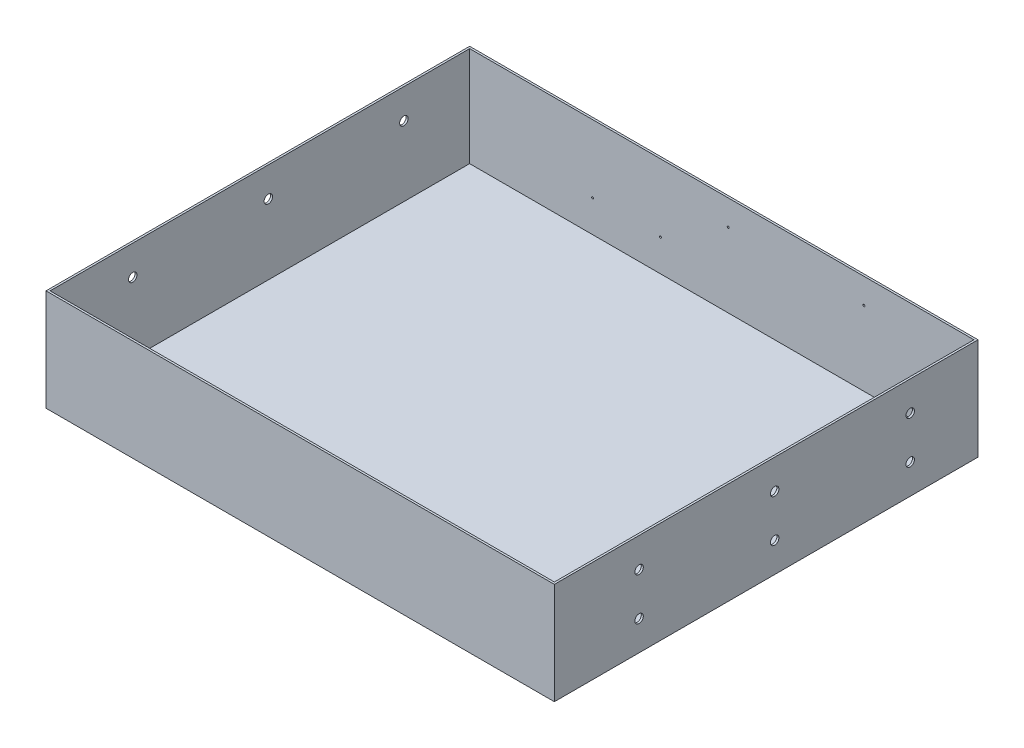
from build123d import *

# Parameters (mm, degrees)
SKETCH1_W                          = 762
SKETCH1_H                          = 635
EXTRUDE1_DEPTH                     = 152.4
SHELL1_T                           = -3.048
SKETCH2_R                          = 6.35
CONNECTOR_MOUNT_CUT_EXTRUDE1_DEPTH = 929.403877631
LPATTERN1_START                    = -508
LPATTERN1_OUTLINE_R                = 6.35
LPATTERN1_DEPTH                    = 3.048
LPATTERN5_START                    = 250.952
LPATTERN5_OUTLINE_R                = 6.35
LPATTERN5_DEPTH                    = 3.048
SKETCH3_R                          = 1.524
CLIP_MOUNT_CUT_EXTRUDE2_DEPTH      = 39.624
LPATTERN2_COUNT                    = 5
LPATTERN2_PITCH                    = 101.6
LPATTERN2_COUNT_DIR2               = 2
LPATTERN2_PITCH_DIR2               = 63.5


# Read off the part's stored shape, not the designer's step: LPattern1, LPattern5
with BuildPart() as part:
    # Sketch1 → Extrude1 (new body)
    with BuildSketch(Plane(origin=(0, 0, 0), x_dir=(1, 0, 0), z_dir=(0, 1, 0))):
        with Locations((-127, 190.5)):
            Rectangle(SKETCH1_W, SKETCH1_H)
    extrude(amount=EXTRUDE1_DEPTH)

    # Shell1
    shell1_openings = [part.faces().sort_by_distance(p)[0] for p in [
        (-127, 152.4, -190.5),
    ]]
    offset(amount=SHELL1_T, openings=shell1_openings, kind=Kind.INTERSECTION)

    # Sketch2 → Connector mount--Cut-Extrude1 (cut, through all)
    with BuildSketch(Plane.ZY.offset(508)):
        with Locations((-406.4, 107.95)):
            Circle(SKETCH2_R)
    extrude(amount=-CONNECTOR_MOUNT_CUT_EXTRUDE1_DEPTH, mode=Mode.SUBTRACT)

    # LPattern1 outline → LPattern1 (cut)
    with BuildSketch(Plane.YZ.offset(LPATTERN1_START)):
        with Locations((107.95, 0)):
            Circle(LPATTERN1_OUTLINE_R)
        with Locations((107.95, -203.2)):
            Circle(LPATTERN1_OUTLINE_R)
    extrude(amount=LPATTERN1_DEPTH, mode=Mode.SUBTRACT)

    # LPattern5 outline → LPattern5 (cut)
    with BuildSketch(Plane.YZ.offset(LPATTERN5_START)):
        with Locations((44.45, 0)):
            Circle(LPATTERN5_OUTLINE_R)
        with Locations((44.45, -203.2)):
            Circle(LPATTERN5_OUTLINE_R)
        with Locations((44.45, -406.4)):
            Circle(LPATTERN5_OUTLINE_R)
        with Locations((107.95, 0)):
            Circle(LPATTERN5_OUTLINE_R)
        with Locations((107.95, -203.2)):
            Circle(LPATTERN5_OUTLINE_R)
    extrude(amount=LPATTERN5_DEPTH, mode=Mode.SUBTRACT)

    # Sketch3 → Clip Mount --Cut-Extrude2 (cut)
    with BuildSketch(Plane(origin=(0, 0, -508), x_dir=(-1, 0, 0), z_dir=(0, 0, -1))):
        with Locations((-85.852, 114.3)):
            Circle(SKETCH3_R)
    clip_mount_cut_extrude2 = extrude(amount=-CLIP_MOUNT_CUT_EXTRUDE2_DEPTH, mode=Mode.SUBTRACT)

    # LPattern2: Clip Mount --Cut-Extrude2 5 × 2, 6 skipped
    with Locations(*[(-i * LPATTERN2_PITCH, -j * LPATTERN2_PITCH_DIR2, 0) for i in range(LPATTERN2_COUNT) for j in range(LPATTERN2_COUNT_DIR2) if (i, j) not in ((0, 0), (0, 1), (1, 0), (1, 1), (2, 1), (3, 0), (4, 0))]):
        add(clip_mount_cut_extrude2, mode=Mode.SUBTRACT)


solid = part.part
